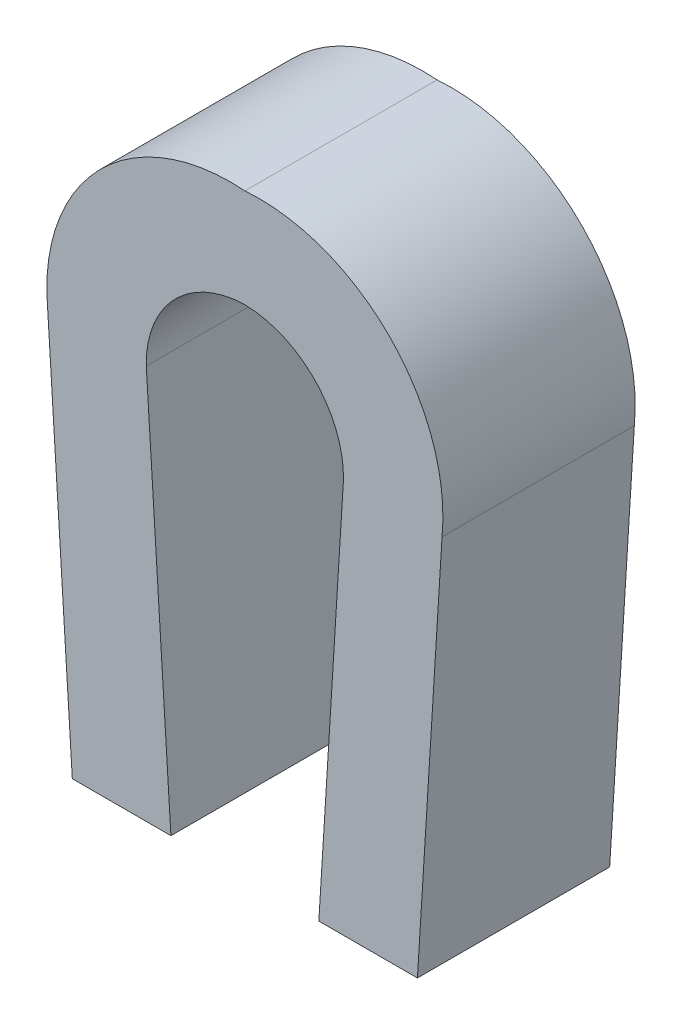
from build123d import *

# Parameters (mm, degrees)
BOSS_EXTRUDE1_DEPTH = 3.9


with BuildPart() as part:
    # Sketch1 → Boss-Extrude1 (new body)
    with BuildSketch(Plane.XY):
        with BuildLine():
            Line((-2, 4), (-1.5, -4))
            Line((-1.5, -4), (-3.5, -4))
            Line((-3.5, -4), (-4, 4))
            ThreePointArc((-4, 4), (-2.950434096, 6.97104187), (0, 8.077214108))
            ThreePointArc((0, 8.077214108), (2.950434096, 6.97104187), (4, 4))
            Line((4, 4), (3.5, -4))
            Line((3.5, -4), (1.5, -4))
            Line((1.5, -4), (2, 4))
            ThreePointArc((2, 4), (1.430965913, 5.453553122), (0, 6.077214108))
            ThreePointArc((0, 6.077214108), (-1.430965913, 5.453553122), (-2, 4))
        make_face()
    extrude(amount=BOSS_EXTRUDE1_DEPTH)


solid = part.part
